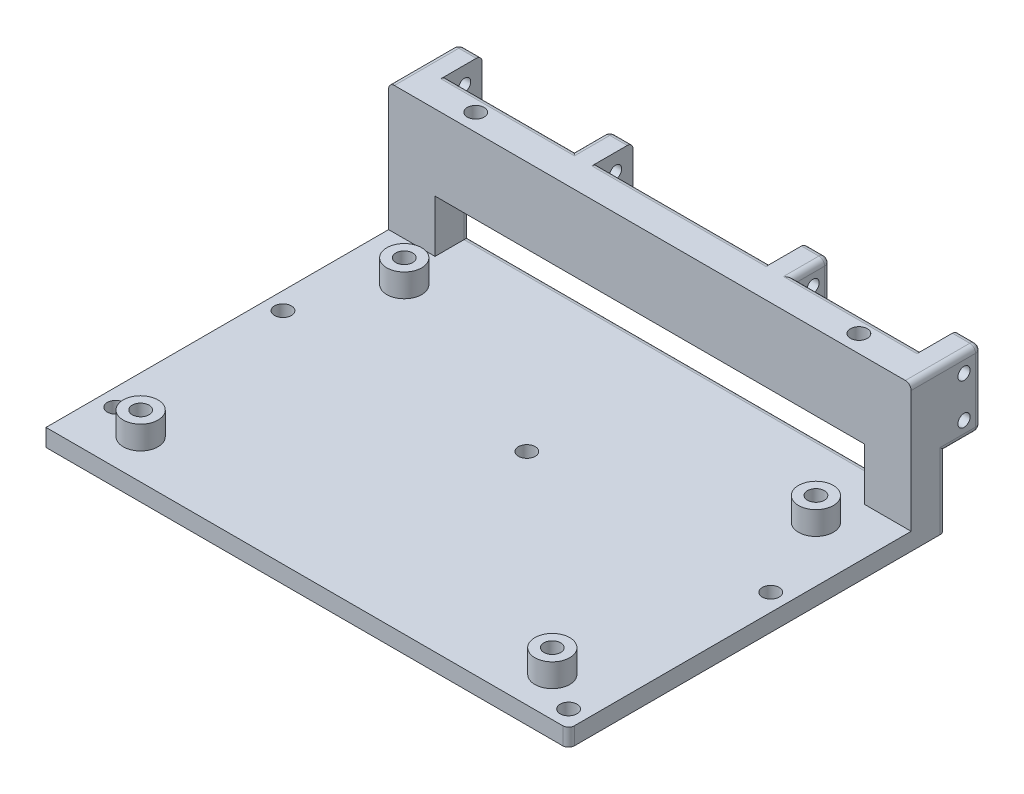
from build123d import *

# Parameters (mm, degrees)
BOSS_EXTRUDE1_DEPTH = 3
SKETCH4_R           = 1.45
CUT_EXTRUDE1_DEPTH  = 4
SKETCH5_W           = 90
SKETCH5_H           = 6
BOSS_EXTRUDE2_DEPTH = 22
SKETCH6_W           = 74
SKETCH6_H           = 9
CUT_EXTRUDE2_DEPTH  = 20
SKETCH8_R           = 3
BOSS_EXTRUDE3_DEPTH = 4
SKETCH9_R           = 1.45
CUT_EXTRUDE3_DEPTH  = 10
SKETCH11_W          = 4
SKETCH11_H          = 13
BOSS_EXTRUDE4_DEPTH = 6.1
SKETCH12_R          = 1.05
CUT_EXTRUDE4_DEPTH  = 100
SKETCH13_R          = 1.45
CUT_EXTRUDE5_DEPTH  = 13
FILLET1_R           = 1


with BuildPart() as part:
    # Sketch1 → Boss-Extrude1 (new body)
    with BuildSketch(Plane(origin=(0, 0, 0), x_dir=(1, 0, 0), z_dir=(0, 1, 0))):
        Polygon((0, -3.187087834), (0, 0), (90, 0), (90, -3.187087834), (90, -65), (0, -65), align=None)
    extrude(amount=BOSS_EXTRUDE1_DEPTH)

    # Sketch4 → Cut-Extrude1 (cut)
    with BuildSketch(Plane(origin=(0, 3, 0), x_dir=(1, 0, 0), z_dir=(0, 1, 0))):
        with Locations((3, -27.187087834)):
            Circle(SKETCH4_R)
        with Locations((45, -27.187087834)):
            Circle(SKETCH4_R)
        with Locations((87, -27.187087834)):
            Circle(SKETCH4_R)
        with Locations((87, -62)):
            Circle(SKETCH4_R)
        with Locations((3, -56)):
            Circle(SKETCH4_R)
    extrude(amount=-CUT_EXTRUDE1_DEPTH, mode=Mode.SUBTRACT)

    # Sketch5 → Boss-Extrude2 (add)
    with BuildSketch(Plane(origin=(0, 3, 0), x_dir=(1, 0, 0), z_dir=(0, 1, 0))):
        with Locations((45, -3)):
            Rectangle(SKETCH5_W, SKETCH5_H)
    extrude(amount=BOSS_EXTRUDE2_DEPTH)

    # Sketch6 → Cut-Extrude2 (cut)
    with BuildSketch(Plane.XY.offset(6)):
        with Locations((45, 7.5)):
            Rectangle(SKETCH6_W, SKETCH6_H)
    extrude(amount=-CUT_EXTRUDE2_DEPTH, mode=Mode.SUBTRACT)

    # Sketch8 → Boss-Extrude3 (add)
    with BuildSketch(Plane(origin=(0, 3, 0), x_dir=(1, 0, 0), z_dir=(0, 1, 0))):
        with Locations((9.55, -12.85)):
            Circle(SKETCH8_R)
        with Locations((80.45, -12.85)):
            Circle(SKETCH8_R)
        with Locations((9.55, -58.25)):
            Circle(SKETCH8_R)
        with Locations((80.45, -58.25)):
            Circle(SKETCH8_R)
    extrude(amount=BOSS_EXTRUDE3_DEPTH)

    # Sketch9 → Cut-Extrude3 (cut)
    with BuildSketch(Plane(origin=(0, 7, 0), x_dir=(1, 0, 0), z_dir=(0, 1, 0))):
        with Locations((9.55, -12.85)):
            Circle(SKETCH9_R)
        with Locations((80.45, -12.85)):
            Circle(SKETCH9_R)
        with Locations((80.45, -58.25)):
            Circle(SKETCH9_R)
        with Locations((9.55, -58.25)):
            Circle(SKETCH9_R)
    extrude(amount=-CUT_EXTRUDE3_DEPTH, mode=Mode.SUBTRACT)

    # Sketch11 → Boss-Extrude4 (add)
    with BuildSketch(Plane(origin=(0, 0, 0), x_dir=(-1, 0, 0), z_dir=(0, 0, -1))):
        with Locations((-88, 18.5)):
            Rectangle(SKETCH11_W, SKETCH11_H)
        with Locations((-2, 18.5)):
            Rectangle(SKETCH11_W, SKETCH11_H)
        with Locations((-62, 18.5)):
            Rectangle(SKETCH11_W, SKETCH11_H)
        with Locations((-28, 18.5)):
            Rectangle(SKETCH11_W, SKETCH11_H)
    extrude(amount=BOSS_EXTRUDE4_DEPTH)

    # Sketch12 → Cut-Extrude4 (cut)
    with BuildSketch(Plane.ZY):
        with Locations((-3.1, 15)):
            Circle(SKETCH12_R)
        with Locations((-3.1, 22)):
            Circle(SKETCH12_R)
    extrude(amount=-CUT_EXTRUDE4_DEPTH, mode=Mode.SUBTRACT)

    # Sketch13 → Cut-Extrude5 (cut)
    with BuildSketch(Plane(origin=(0, 25, 0), x_dir=(1, 0, 0), z_dir=(0, 1, 0))):
        with Locations((12, -3)):
            Circle(SKETCH13_R)
        with Locations((78, -3)):
            Circle(SKETCH13_R)
    extrude(amount=-CUT_EXTRUDE5_DEPTH, mode=Mode.SUBTRACT)

    # Fillet1
    fillet1_edges = [part.edges().sort_by_distance(p)[0] for p in [
        (88, 12, -6.1),
        (88, 25, -6.1),
        (62, 12, -6.1),
        (62, 25, -6.1),
        (28, 12, -6.1),
        (28, 25, -6.1),
        (2, 12, -6.1),
        (2, 25, -6.1),
        (90, 1.5, 65),
        (90, 6, 0),
        (90, 12, -3.05),
        (90, 18.5, -6.1),
        (90, 25, -0.05),
        (64, 25, -3.05),
        (64, 18.5, -6.1),
        (64, 12, -3.05),
        (17, 12, 0),
        (8, 7.5, 0),
        (45, 3, 0),
        (82, 7.5, 0),
        (73, 12, 0),
        (75, 25, 0),
        (45, 12, 0),
        (45, 25, 0),
        (26, 12, -3.05),
        (26, 25, -3.05),
        (0, 12, -3.05),
        (0, 25, -0.05),
        (15, 25, 0),
        (26, 18.5, -6.1),
        (0, 18.5, -6.1),
        (0, 6, 0),
    ]]
    fillet(fillet1_edges, radius=FILLET1_R)


solid = part.part
